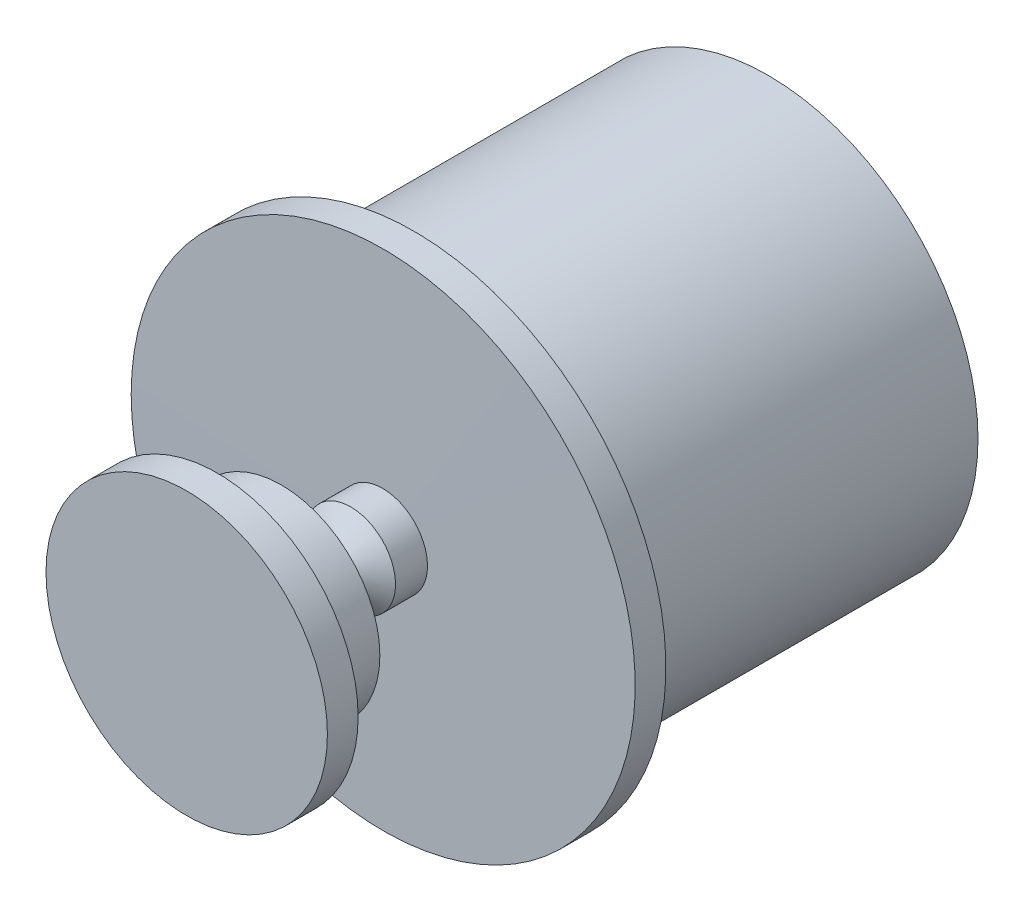
from build123d import *

# Parameters (mm, degrees)
SKETCH_14_W = 110
SKETCH_14_H = 12


with BuildPart() as part:
    # Эскиз14 → Повернуть11 (revolve)
    with BuildSketch(Plane(origin=(0, 0, 0), x_dir=(1, 0, 0), z_dir=(0, 1, 0))):
        with Locations((-55, -447)):
            Rectangle(SKETCH_14_W, SKETCH_14_H)
    revolve(axis=Axis((0, 0, 600), (0, 0, -1)))

    # Эскиз15 → Повернуть12 (revolve)
    with BuildSketch(Plane(origin=(0, 0, 0), x_dir=(1, 0, 0), z_dir=(0, 1, 0))):
        Polygon((-110, -441), (-110, -429), (-77, -429), (-77, -379), (-15, -379), (-15, -381), (-75, -381), (-75, -441), align=None)
    revolve(axis=Axis((0, 0, 0), (0, 0, 1)))

    # Эскиз16 → Повернуть17 (revolve)
    with BuildSketch(Plane(origin=(0, 0, 0), x_dir=(1, 0, 0), z_dir=(0, 1, 0))):
        Polygon((-15, -381), (-13, -381), (-13, -332.5), (-11.5, -332.5), (-11.5, -304.5), (-18.2, -304.5), (-17.3, -307.5), (-15.7, -307.5), (-15, -305.5), (-13, -305.5), (-13, -331), (-15, -331), align=None)
    revolve(axis=Axis((0, 0, 0), (0, 0, 1)))

    # Эскиз17 → Повернуть19 (revolve)
    with BuildSketch(Plane(origin=(0, 0, 0), x_dir=(1, 0, 0), z_dir=(0, 1, 0))):
        Polygon((-16.5, -341), (-15, -341), (-15, -336.62), (-33.5, -323.4), (-33.5, -283.4), (-159.5, -283.4), (-159.5, -287.4), (-197, -287.4), (-197, -299.4), (-35, -299.78), (-35, -324.78), (-16.5, -338), align=None)
    revolve(axis=Axis((0, 0, 0), (0, 0, 1)))

    # Эскиз18 → Повернуть20 (revolve)
    with BuildSketch(Plane(origin=(0, 0, 0), x_dir=(1, 0, 0), z_dir=(0, 1, 0))):
        Polygon((-197, -287.4), (-197, -275.4), (-170, -275.4), (-170, -277.4), (-166, -277.4), (-166, -275.4), (-164, -275.4), (-164, 1.6), (-162, 1.6), (-162, -6.4), (-160, -6.4), (-160, -287.4), (-165, -287.4), (-165, -282.4), (-170, -282.4), (-170, -287.4), align=None)
    revolve(axis=Axis((0, 0, 0), (0, 0, 1)))

    # Эскиз19 → Повернуть21 (revolve)
    with BuildSketch(Plane(origin=(0, 0, 0), x_dir=(1, 0, 0), z_dir=(0, 1, 0))):
        Polygon((-162, 1.6), (-160, 1.6), (-160, -0.4), (-157, -0.4), (-157, 1.6), (-64.5, 1.6), (-64.5, -0.4), (-61.5, -0.4), (-61.5, 1.6), (-59.5, 1.6), (-59.5, -0.4), (-56.5, -0.4), (-56.5, 1.6), (-30.5, 1.6), (-25.5, -6.4), (-25.5, -7.4), (-150, -7.4), (-154, -3.4), (-162, -3.4), align=None)
    revolve(axis=Axis((0, 0, 0), (0, 0, 1)))


with BuildPart() as body_2:
    # Эскиз20 → Повернуть22 (revolve)
    with BuildSketch(Plane(origin=(0, 0, 0), x_dir=(1, 0, 0), z_dir=(0, 1, 0))):
        Polygon((-156.5, -243.4), (-12.5, -243.4), (-12.5, -227.4), (-14.5, -227.4), (-14.5, -229.4), (-16.5, -229.4), (-16.5, -227.4), (-119.5, -227.4), (-119.5, -233.4), (-130.5, -233.4), (-130.5, -230.4), (-136.5, -230.4), (-136.5, -233.4), (-156.5, -233.4), align=None)
    revolve(axis=Axis((0, 0, 0), (0, 0, 1)))

    # Эскиз21 → Повернуть26 (revolve)
    with BuildSketch(Plane(origin=(0, 0, 0), x_dir=(1, 0, 0), z_dir=(0, 1, 0))):
        Polygon((-18.2, -251), (-10.2, -251), (-10.2, -227.4), (-12.5, -227.4), (-12.5, -250), (-15.03, -250), (-15.7, -247.5), (-17.3, -247.5), align=None)
        Polygon((-19.5, -301.5), (-17, -301.5), (-18.479019946, -300.5), (-17.003480047, -299.907647059), (-18.479019946, -298.91), (-17.003480047, -298.317647059), (-18.479019946, -297.32), (-17.003480047, -296.727647059), (-18.479019946, -295.73), (-17.003480047, -295.137647059), (-18.479019946, -294.14), (-17.003480047, -293.547647059), (-18.479019946, -292.55), (-17.003480047, -291.957647059), (-18.479019946, -290.96), (-17.003480047, -290.367647059), (-18.479019946, -289.37), (-17.003480047, -288.777647059), (-18.479019946, -287.78), (-17.003480047, -287.187647059), (-18.479019946, -286.19), (-17.003480047, -285.597647059), (-18.479019946, -284.6), (-17.003480047, -284.007647059), (-18.479019946, -283.01), (-17.003480047, -282.417647059), (-18.479019946, -281.42), (-17.003480047, -280.827647059), (-18.479019946, -279.83), (-17.003480047, -279.237647059), (-18.479019946, -278.24), (-17.003480047, -277.647647059), (-18.479019946, -276.65), (-17.003480047, -276.057647059), (-18.479019946, -275.06), (-17.003480047, -274.467647059), (-18.479019946, -273.47), (-17.003480047, -272.877647059), (-18.479019946, -271.88), (-17.003480047, -271.287647059), (-18.479019946, -270.29), (-17.003480047, -269.697647059), (-18.479019946, -268.7), (-17.003480047, -268.107647059), (-18.479019946, -267.11), (-17.003480047, -266.517647059), (-18.479019946, -265.52), (-17.003480047, -264.927647059), (-18.479019946, -263.93), (-17.003480047, -263.337647059), (-18.479019946, -262.34), (-17.003480047, -261.747647059), (-18.479019946, -260.75), (-17.003480047, -260.157647059), (-18.479019946, -259.16), (-17.003480047, -258.567647059), (-18.479019946, -257.57), (-17.003480047, -256.977647059), (-18.479019946, -255.98), (-17.003480047, -255.387647059), (-18.479019946, -254.39), (-17, -253.79625), (-17, -253.5), (-19.5, -253.5), align=None)
    revolve(axis=Axis((0, 0, 0), (0, 0, 1)))


with BuildPart() as revolve_26_piece_1:
    # of the separate pieces the step leaves, piece 1, a body of its own (revolve_26_pieces)
    add(body_2.part.solids().sort_by_distance((-156.5, 0, 243.4))[0])


with BuildPart() as revolve_26_piece_2:
    # of the separate pieces the step leaves, piece 2, a body of its own (revolve_26_pieces)
    add(body_2.part.solids().sort_by_distance((-19.5, 0, 301.5))[0])


solid = Compound([part.part, revolve_26_piece_1.part, revolve_26_piece_2.part])
